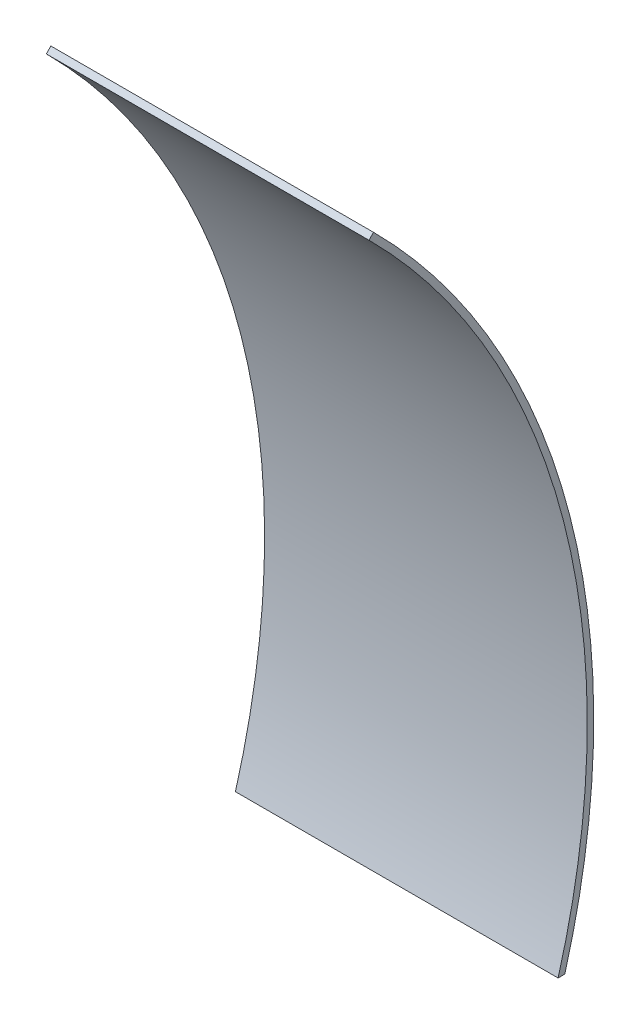
from build123d import *

# Parameters (mm, degrees)
BOSS_EXTRUDE1_DEPTH = 79.375


with BuildPart() as part:
    # Sketch1 → Boss-Extrude1 (new body)
    with BuildSketch(Plane(origin=(0, 0, 0), x_dir=(0, 0, -1), z_dir=(1, 0, 0))):
        with BuildLine():
            Line((176.178529946, -50.8), (177.830117427, -50.8))
            ThreePointArc((177.830117427, -50.8), (179.02973167, 46.395536878), (130.774979763, 130.774979763))
            Line((130.774979763, 130.774979763), (129.652447748, 129.652447748))
            ThreePointArc((129.652447748, 129.652447748), (169.399086533, 70.167399096), (183.35625, 0))
            ThreePointArc((183.35625, 0), (181.552952325, -25.652288715), (176.178529946, -50.8))
        make_face()
    extrude(amount=BOSS_EXTRUDE1_DEPTH)


solid = part.part
